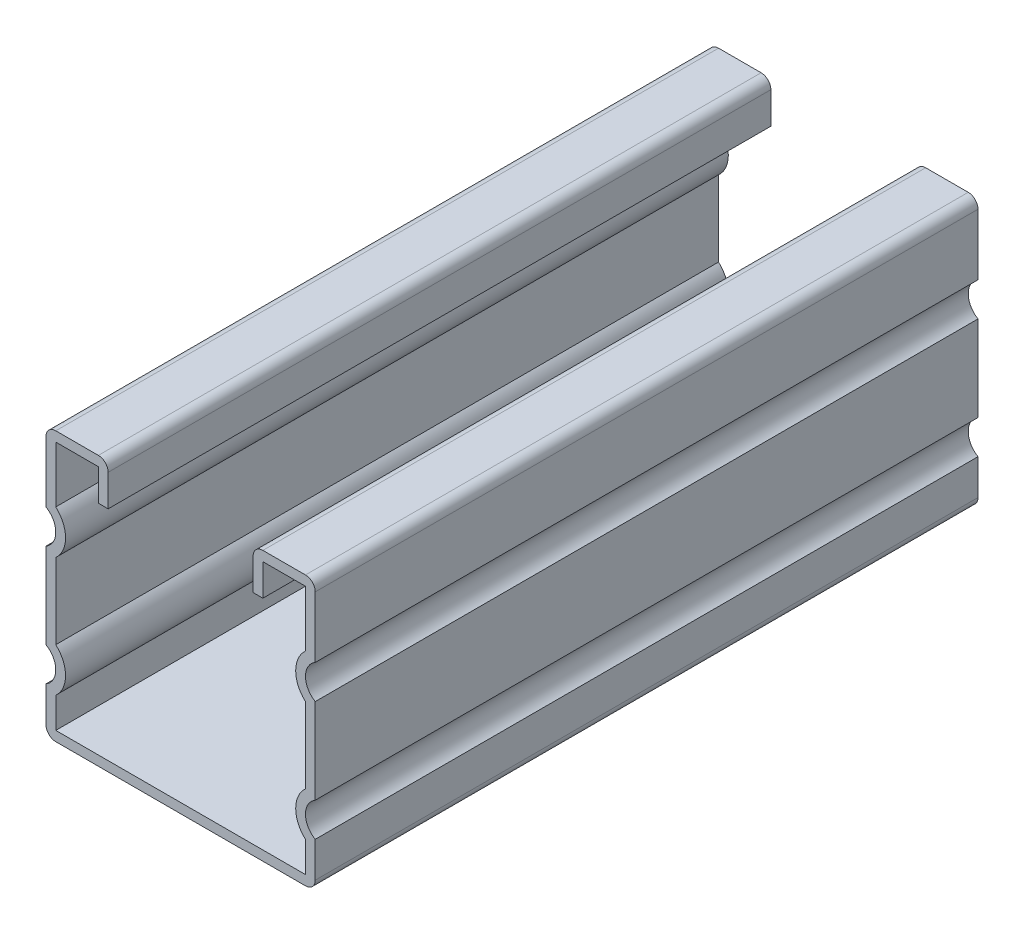
from build123d import *

# Parameters (mm, degrees)
BASE_EXTRUDE_DEPTH = 101.6
HOLE1_START        = -18.669
HOLE1_OUTLINE_R    = 7.14375
HOLE1_DEPTH        = 1.4986
LPATTERN2_COUNT    = 2
LPATTERN2_PITCH    = 47.625


# Read off the part's stored shape, not the designer's step: Hole1
with BuildPart() as part:
    # Sketch1 → Base-Extrude (new body)
    with BuildSketch(Plane.XY):
        with BuildLine():
            Line((-20.6375, 21.1074), (-20.6375, 11.73965134))
            ThreePointArc((-20.6375, 11.73965134), (-19.1389, 9.144), (-20.6375, 6.54834866))
            Line((-20.6375, 6.54834866), (-20.6375, -6.54834866))
            ThreePointArc((-20.6375, -6.54834866), (-19.1389, -9.144), (-20.6375, -11.73965134))
            Line((-20.6375, -11.73965134), (-20.6375, -17.1704))
            ThreePointArc((-20.6375, -17.1704), (-20.198570222, -18.230070222), (-19.1389, -18.669))
            Line((-19.1389, -18.669), (19.1389, -18.669))
            ThreePointArc((19.1389, -18.669), (20.198570222, -18.230070222), (20.6375, -17.1704))
            Line((20.6375, -17.1704), (20.6375, -11.73965134))
            ThreePointArc((20.6375, -11.73965134), (19.1389, -9.144), (20.6375, -6.54834866))
            Line((20.6375, -6.54834866), (20.6375, 6.54834866))
            ThreePointArc((20.6375, 6.54834866), (19.1389, 9.144), (20.6375, 11.73965134))
            Line((20.6375, 11.73965134), (20.6375, 21.1074))
            ThreePointArc((20.6375, 21.1074), (20.198570222, 22.167070222), (19.1389, 22.606))
            Line((19.1389, 22.606), (12.6111, 22.606))
            ThreePointArc((12.6111, 22.606), (11.551429778, 22.167070222), (11.1125, 21.1074))
            Line((11.1125, 21.1074), (11.1125, 16.256))
            Line((11.1125, 16.256), (12.6111, 16.256))
            Line((12.6111, 16.256), (12.6111, 21.1074))
            Line((12.6111, 21.1074), (19.1389, 21.1074))
            Line((19.1389, 21.1074), (19.1389, 12.494971471))
            ThreePointArc((19.1389, 12.494971471), (17.6403, 9.144), (19.1389, 5.793028529))
            Line((19.1389, 5.793028529), (19.1389, -5.793028529))
            ThreePointArc((19.1389, -5.793028529), (17.6403, -9.144), (19.1389, -12.494971471))
            Line((19.1389, -12.494971471), (19.1389, -17.1704))
            Line((19.1389, -17.1704), (-19.1389, -17.1704))
            Line((-19.1389, -17.1704), (-19.1389, -12.494971471))
            ThreePointArc((-19.1389, -12.494971471), (-17.6403, -9.144), (-19.1389, -5.793028529))
            Line((-19.1389, -5.793028529), (-19.1389, 5.793028529))
            ThreePointArc((-19.1389, 5.793028529), (-17.6403, 9.144), (-19.1389, 12.494971471))
            Line((-19.1389, 12.494971471), (-19.1389, 21.1074))
            Line((-19.1389, 21.1074), (-12.6111, 21.1074))
            Line((-12.6111, 21.1074), (-12.6111, 16.256))
            Line((-12.6111, 16.256), (-11.1125, 16.256))
            Line((-11.1125, 16.256), (-11.1125, 21.1074))
            ThreePointArc((-11.1125, 21.1074), (-11.551429778, 22.167070222), (-12.6111, 22.606))
            Line((-12.6111, 22.606), (-19.1389, 22.606))
            ThreePointArc((-19.1389, 22.606), (-20.198570222, 22.167070222), (-20.6375, 21.1074))
        make_face()
    extrude(amount=BASE_EXTRUDE_DEPTH)

    # Hole1 outline → Hole1 (cut)
    with BuildSketch(Plane(origin=(0, 0, 0), x_dir=(1, 0, 0), z_dir=(0, 1, 0)).offset(HOLE1_START)):
        with Locations((0, -23.8125)):
            Circle(HOLE1_OUTLINE_R)
    hole1 = extrude(amount=HOLE1_DEPTH, mode=Mode.SUBTRACT)

    # LPattern2: Hole1 ×2
    with Locations(*[(0, 0, i * LPATTERN2_PITCH) for i in range(1, LPATTERN2_COUNT)]):
        add(hole1, mode=Mode.SUBTRACT)


solid = part.part
